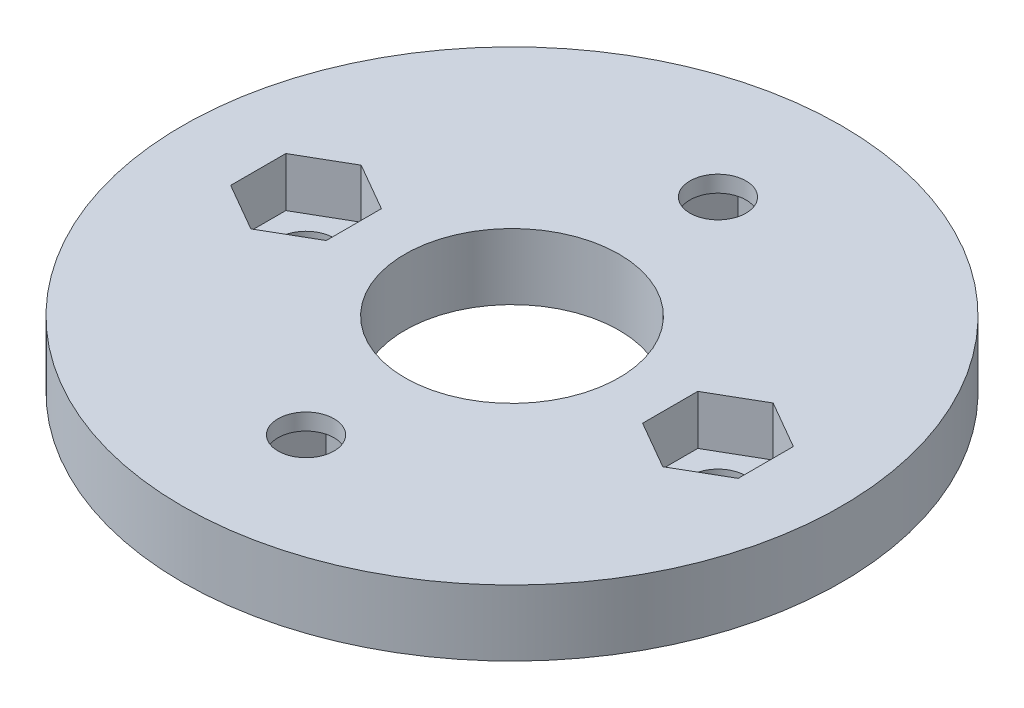
from build123d import *

# Parameters (mm, degrees)
SKETCH_1_R               = 20
SKETCH_1_R_2             = 6.5
EXTRUDE_369_DEPTH        = 4
CUT_EXTRUDE_599_DEPTH    = 3
SKETCH_3_R               = 1.7
CUT_EXTRUDE_788_DEPTH    = 29.442925307
PATTERN_CIRCULAR_1_COUNT = 4
CUT_EXTRUDE_1523_DEPTH   = 3


with BuildPart() as part:
    # Эскиз1 → Extrude 369 (new body)
    with BuildSketch(Plane(origin=(0, 0, 0), x_dir=(1, 0, 0), z_dir=(0, 1, 0))):
        Circle(SKETCH_1_R)
        Circle(SKETCH_1_R_2, mode=Mode.SUBTRACT)
    extrude(amount=EXTRUDE_369_DEPTH)

    # Эскиз2 → Cut-Extrude 599 (cut)
    with BuildSketch(Plane(origin=(0, 4, 0), x_dir=(1, 0, 0), z_dir=(0, 1, 0))):
        Polygon((-15.4, -1.674315781), (-12.5, -3.348631561), (-9.6, -1.674315781), (-9.6, 1.674315781), (-12.5, 3.348631561), (-15.4, 1.674315781), align=None)
        Polygon((15.4, 1.674315781), (12.5, 3.348631561), (9.6, 1.674315781), (9.6, -1.674315781), (12.5, -3.348631561), (15.4, -1.674315781), align=None)
    extrude(amount=-CUT_EXTRUDE_599_DEPTH, mode=Mode.SUBTRACT)

    # Эскиз3 → Cut-Extrude 788 (cut, symmetric)
    with BuildSketch(Plane(origin=(0, 1, 0), x_dir=(1, 0, 0), z_dir=(0, 1, 0))):
        with Locations((12.5, 0)):
            Circle(SKETCH_3_R)
    cut_extrude_788 = extrude(amount=CUT_EXTRUDE_788_DEPTH, both=True, mode=Mode.SUBTRACT)

    # Круговой массив1: Cut-Extrude 788 ×4 about axis
    pattern_circular_1_axis = Axis((0, 4, 0), (0, -1, 0))
    for i in range(1, PATTERN_CIRCULAR_1_COUNT):
        add(cut_extrude_788.rotate(pattern_circular_1_axis, i * 360 / PATTERN_CIRCULAR_1_COUNT), mode=Mode.SUBTRACT)

    # Эскиз5 → Cut-Extrude 1523 (cut)
    with BuildSketch(Plane.XZ):
        Polygon((3.348631561, 12.5), (1.674315781, 15.4), (-1.674315781, 15.4), (-3.348631561, 12.5), (-1.674315781, 9.6), (1.674315781, 9.6), align=None)
        Polygon((-3.348631561, -12.5), (-1.674315781, -15.4), (1.674315781, -15.4), (3.348631561, -12.5), (1.674315781, -9.6), (-1.674315781, -9.6), align=None)
    extrude(amount=-CUT_EXTRUDE_1523_DEPTH, mode=Mode.SUBTRACT)


solid = part.part
